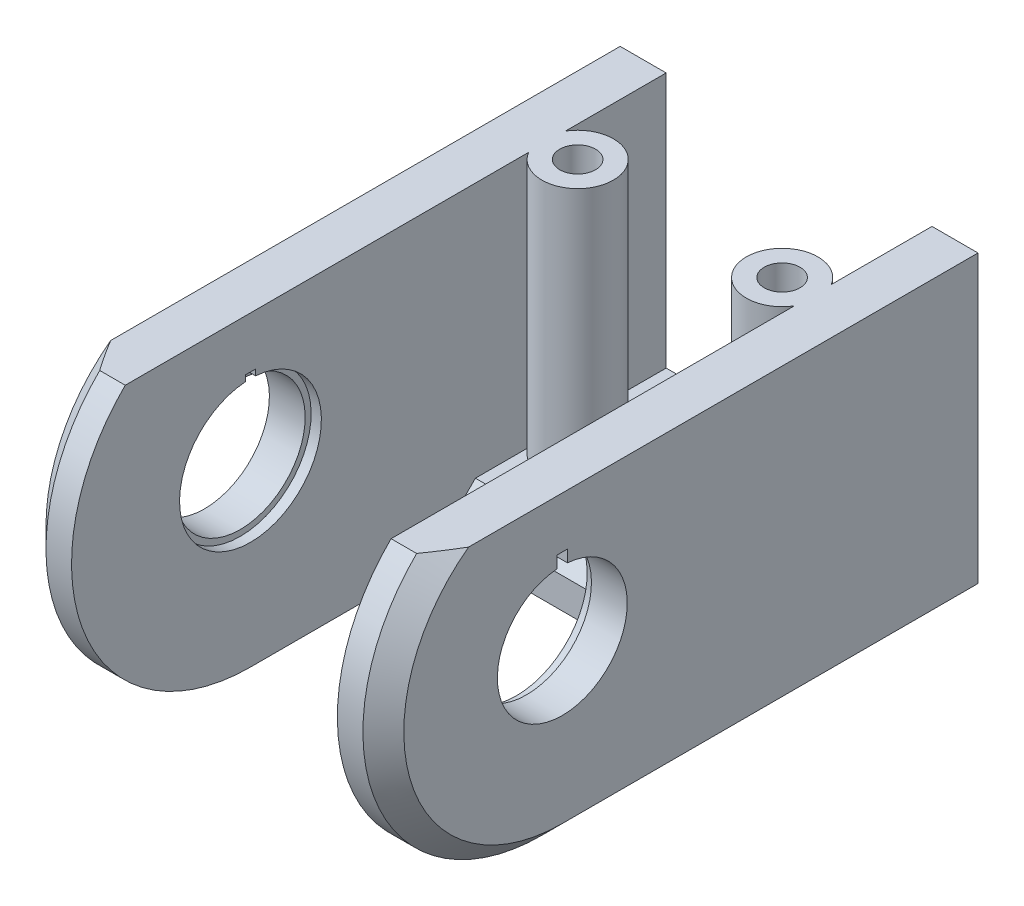
from build123d import *

# Parameters (mm, degrees)
SKETCH1_R               = 6.35
BOSS_EXTRUDE1_DEPTH     = 17.5
CUT_EXTRUDE1_DEPTH      = 13
CHAMFER1_SIZE           = 2
SKETCH4_R               = 3.5
BOSS_EXTRUDE2_DEPTH     = 25
SKETCH6_R               = 1.75
CUT_EXTRUDE2_DEPTH      = 30
SKETCH7_R               = 2.5
CUT_EXTRUDE3_DEPTH      = 3.5
CUT_EXTRUDE4_DEPTH      = 101.436547133
CUT_EXTRUDE4_DEPTH_BACK = 101.436547133
SKETCH8_W               = 138.060190548
SKETCH8_H               = 48.357154547
SKETCH9_R               = 6.935
CUT_EXTRUDE5_DEPTH      = 1
MIRROR1_START           = -12.5
MIRROR1_OUTLINE_R       = 1.75
MIRROR1_DEPTH           = 25
MIRROR1_START_2         = -17.5
MIRROR1_2_OUTLINE_R     = 2.5
MIRROR1_2_DEPTH         = 3.5
MIRROR1_START_3         = -14
MIRROR1_3_OUTLINE_R     = 1.75
MIRROR1_3_DEPTH         = 1.5
MIRROR1_4_OUTLINE_R     = 6.935
MIRROR1_4_OUTLINE_R_2   = 6.35
MIRROR1_4_DEPTH         = 1
CUT_EXTRUDE6_DEPTH      = 101.436547133
CUT_EXTRUDE6_DEPTH_BACK = 101.436547133
SKETCH10_W              = 1
SKETCH10_H              = 7.5


# Read off the part's stored shape, not the designer's step: Mirror1
with BuildPart() as part:
    # Sketch1 → Boss-Extrude1 (new, symmetric)
    with BuildSketch(Plane(origin=(0, 0, 0), x_dir=(0, 0, -1), z_dir=(1, 0, 0))):
        with BuildLine():
            Line((-75, -17.5), (75, -17.5))
            ThreePointArc((75, -17.5), (91.201851746, -6.614378278), (87.247448714, 12.5))
            Line((87.247448714, 12.5), (-87.247448714, 12.5))
            ThreePointArc((-87.247448714, 12.5), (-91.201851746, -6.614378278), (-75, -17.5))
        make_face()
        with Locations((-75, 0)):
            Circle(SKETCH1_R, mode=Mode.SUBTRACT)
        with Locations((75, 0)):
            Circle(SKETCH1_R, mode=Mode.SUBTRACT)
    extrude(amount=BOSS_EXTRUDE1_DEPTH, both=True)

    # Sketch3 → Cut-Extrude1 (cut, symmetric)
    with BuildSketch(Plane(origin=(0, 0, 0), x_dir=(0, 0, -1), z_dir=(1, 0, 0))):
        with BuildLine():
            Line((-92.5, 12.5), (75, 12.5))
            ThreePointArc((75, 12.5), (87.5, 0), (75, -12.5))
            Line((75, -12.5), (-55, -12.5))
            Line((-55, -12.5), (-55, -17.5))
            Line((-55, -17.5), (-92.5, -17.5))
            Line((-92.5, -17.5), (-92.5, 12.5))
        make_face()
    extrude(amount=CUT_EXTRUDE1_DEPTH, both=True, mode=Mode.SUBTRACT)

    # Chamfer1
    chamfer1_edges = [part.edges().sort_by_distance(p)[0] for p in [
        (17.5, -6.614378278, -91.201851746),
        (0, -12.5, 55),
        (17.5, -6.614378278, 91.201851746),
        (-17.5, -6.614378278, -91.201851746),
        (-17.5, -17.5, 0),
        (-17.5, -6.614378278, 91.201851746),
        (17.5, -17.5, 0),
    ]]
    chamfer(chamfer1_edges, length=CHAMFER1_SIZE)

    # Sketch4 → Boss-Extrude2 (add)
    with BuildSketch(Plane(origin=(0, -12.5, 0), x_dir=(1, 0, 0), z_dir=(0, 1, 0))):
        with Locations((-10, 62.5)):
            Circle(SKETCH4_R)
        with Locations((-10, 26.333333333)):
            Circle(SKETCH4_R)
        with Locations((-10, -9.833333333)):
            Circle(SKETCH4_R)
        with Locations((-10, -46)):
            Circle(SKETCH4_R)
    extrude(amount=BOSS_EXTRUDE2_DEPTH)

    # Sketch6 → Cut-Extrude2 (cut)
    with BuildSketch(Plane(origin=(0, 12.5, 0), x_dir=(1, 0, 0), z_dir=(0, 1, 0))):
        with Locations(Location((-10, 62.5, 0), (0, 0, 270))):
            Circle(SKETCH6_R)
        with Locations(Location((-10, 26.333333333, 0), (0, 0, 270))):
            Circle(SKETCH6_R)
        with Locations(Location((-10, -9.833333333, 0), (0, 0, 270))):
            Circle(SKETCH6_R)
        with Locations(Location((-10, -46, 0), (0, 0, 270))):
            Circle(SKETCH6_R)
    extrude(amount=-CUT_EXTRUDE2_DEPTH, mode=Mode.SUBTRACT)

    # Sketch7 → Cut-Extrude3 (cut)
    with BuildSketch(Plane.XZ.offset(17.5)):
        with Locations(Location((-10, 46, 0), (0, 0, 270))):
            Circle(SKETCH7_R)
        with Locations(Location((-10, 9.833333333, 0), (0, 0, 270))):
            Circle(SKETCH7_R)
        with Locations(Location((-10, -26.333333333, 0), (0, 0, 270))):
            Circle(SKETCH7_R)
        with Locations(Location((-10, -62.5, 0), (0, 0, 270))):
            Circle(SKETCH7_R)
    extrude(amount=-CUT_EXTRUDE3_DEPTH, mode=Mode.SUBTRACT)

    # Sketch8 → Cut-Extrude4 (cut, two sides: drawn at the far end of the back side and taken through both)
    with BuildSketch(Plane(origin=(17.5, 0, 0), x_dir=(0, 0, -1), z_dir=(1, 0, 0)).offset(-CUT_EXTRUDE4_DEPTH_BACK)):
        with Locations((34.687663788, -4.667734514)):
            Rectangle(SKETCH8_W, SKETCH8_H)
    extrude(amount=CUT_EXTRUDE4_DEPTH + CUT_EXTRUDE4_DEPTH_BACK, mode=Mode.SUBTRACT)

    # Sketch9 → Cut-Extrude5 (cut)
    with BuildSketch(Plane.ZY.offset(-13)):
        with Locations((75, 0)):
            Circle(SKETCH9_R)
    extrude(amount=-CUT_EXTRUDE5_DEPTH, mode=Mode.SUBTRACT)

    # Mirror1 outline → Mirror1 (add)
    with BuildSketch(Plane(origin=(0, 0, 0), x_dir=(1, 0, 0), z_dir=(0, 1, 0)).offset(MIRROR1_START)):
        with BuildLine():
            ThreePointArc((13, -44.197224362), (6.5, -46), (13, -47.802775638))
            Line((13, -47.802775638), (13, -44.197224362))
        make_face()
        with Locations((10, -46)):
            Circle(MIRROR1_OUTLINE_R, mode=Mode.SUBTRACT)
    extrude(amount=MIRROR1_DEPTH)

    # Mirror1 2 outline → Mirror1 2 (cut)
    with BuildSketch(Plane(origin=(0, 0, 0), x_dir=(1, 0, 0), z_dir=(0, 1, 0)).offset(MIRROR1_START_2)):
        with Locations((10, -46)):
            Circle(MIRROR1_2_OUTLINE_R)
    extrude(amount=MIRROR1_2_DEPTH, mode=Mode.SUBTRACT)

    # Mirror1 3 outline → Mirror1 3 (cut)
    with BuildSketch(Plane(origin=(0, 0, 0), x_dir=(1, 0, 0), z_dir=(0, 1, 0)).offset(MIRROR1_START_3)):
        with Locations((10, -46)):
            Circle(MIRROR1_3_OUTLINE_R)
    extrude(amount=MIRROR1_3_DEPTH, mode=Mode.SUBTRACT)

    # Mirror1 4 outline → Mirror1 4 (cut)
    with BuildSketch(Plane.YZ.offset(MIRROR1_START_3)):
        with Locations((0, 75)):
            Circle(MIRROR1_4_OUTLINE_R)
        with Locations((0, 75)):
            Circle(MIRROR1_4_OUTLINE_R_2, mode=Mode.SUBTRACT)
    extrude(amount=MIRROR1_4_DEPTH, mode=Mode.SUBTRACT)

    # Sketch10 → Cut-Extrude6 (cut, two sides: drawn at the far end of the back side and taken through both)
    with BuildSketch(Plane.ZY.offset(17.5).offset(-CUT_EXTRUDE6_DEPTH_BACK)):
        with Locations((75, 3.75)):
            Rectangle(SKETCH10_W, SKETCH10_H)
    extrude(amount=CUT_EXTRUDE6_DEPTH + CUT_EXTRUDE6_DEPTH_BACK, mode=Mode.SUBTRACT)


solid = part.part
